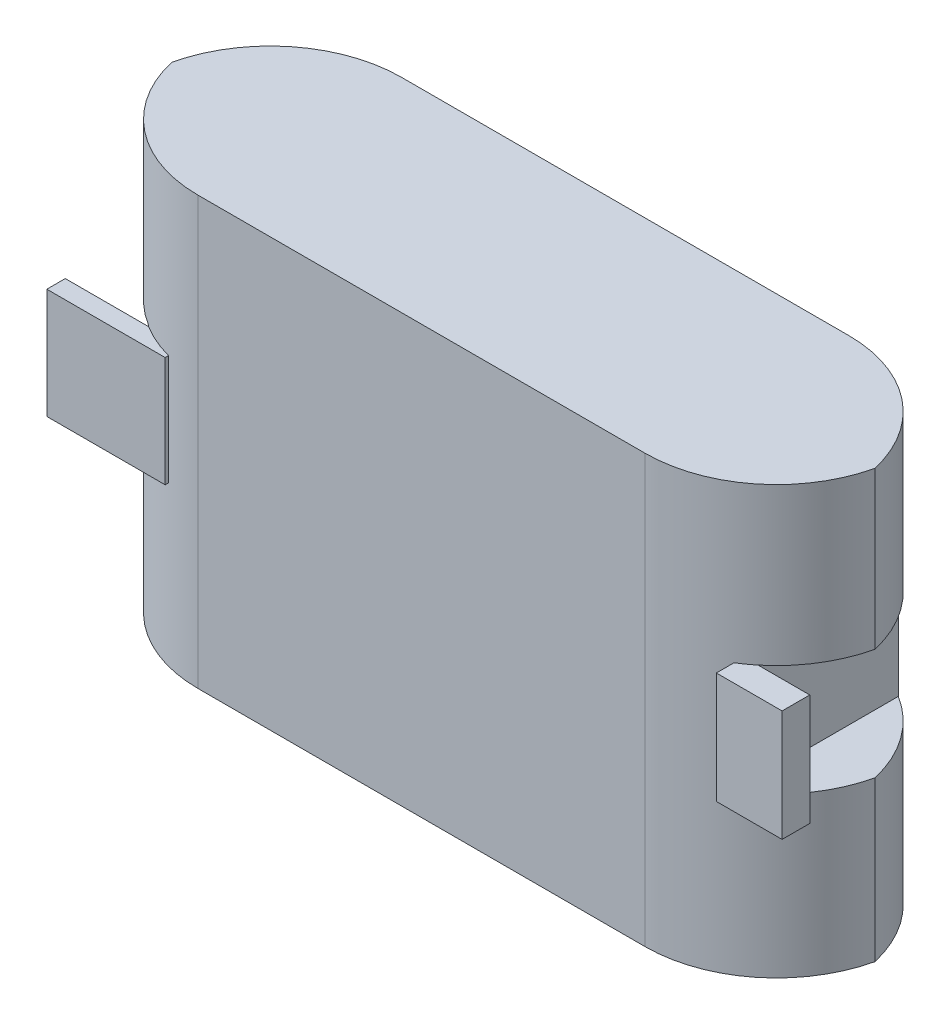
from build123d import *

# Parameters (mm, degrees)
SKETCH1_W           = 108
SKETCH1_H           = 65
BOSS_EXTRUDE1_DEPTH = 31
FILLET1_R           = 20
SKETCH2_W           = 11.536276889
SKETCH2_H           = 16.92742392
SKETCH2_W_2         = 26.268605015
CUT_EXTRUDE1_DEPTH  = 28
SKETCH3_W           = 2.805413746
SKETCH3_H           = 16.76973244
BOSS_EXTRUDE2_DEPTH = 18
SKETCH4_W           = 4.207099317
SKETCH4_H           = 16.92742392
BOSS_EXTRUDE3_DEPTH = 10


with BuildPart() as part:
    # Sketch1 → Boss-Extrude1 (new body)
    with BuildSketch(Plane.XY):
        with Locations((7.455924682, 4.284519209)):
            Rectangle(SKETCH1_W, SKETCH1_H)
    extrude(amount=BOSS_EXTRUDE1_DEPTH)

    # Fillet1
    # the kernel refuses this fillet: 20 mm, written as the material it takes off along each edge
    with BuildSketch(Plane(origin=(61.455924682, 86.784519209, 0), x_dir=(0, 0, 1), z_dir=(0, -1, 0)), Plane(origin=(-46.544075318, -78.215480791, 0), x_dir=(0, 0, 1), z_dir=(0, 1, 0))) as fillet1_piece_1:
        with BuildLine():
            CenterArc((FILLET1_R, FILLET1_R), FILLET1_R, 180, 90)
            Line((0, FILLET1_R), (0, 0))
            Line((0, 0), (FILLET1_R, 0))
        make_face()
    extrude(amount=165, mode=Mode.SUBTRACT)
    with BuildSketch(Plane(origin=(61.455924682, 86.784519209, 31), x_dir=(0, 0, -1), z_dir=(0, -1, 0)), Plane(origin=(-46.544075318, -78.215480791, 31), x_dir=(0, 0, -1), z_dir=(0, 1, 0))) as fillet1_piece_2:
        with BuildLine():
            CenterArc((FILLET1_R, -FILLET1_R), FILLET1_R, 90, 90)
            Line((0, -FILLET1_R), (0, 0))
            Line((0, 0), (FILLET1_R, 0))
        make_face()
    extrude(amount=165, mode=Mode.SUBTRACT)

    # Sketch2 → Cut-Extrude1 (cut)
    with BuildSketch(Plane(origin=(0, 0, 0), x_dir=(-1, 0, 0), z_dir=(0, 0, -1))):
        with Locations((-57.764364891, 4.474974683)):
            Rectangle(SKETCH2_W, SKETCH2_H)
        with Locations((44.830685277, 4.474974683)):
            Rectangle(SKETCH2_W_2, SKETCH2_H)
    extrude(amount=-CUT_EXTRUDE1_DEPTH, mode=Mode.SUBTRACT)

    # Sketch3 → Boss-Extrude2 (add)
    with BuildSketch(Plane.ZY.offset(31.696382769)):
        with Locations((29.429796439, 4.342088928)):
            Rectangle(SKETCH3_W, SKETCH3_H)
    extrude(amount=BOSS_EXTRUDE2_DEPTH)

    # Sketch4 → Boss-Extrude3 (add)
    with BuildSketch(Plane(origin=(51.996226446, 0, 0), x_dir=(0, 0, -1), z_dir=(1, 0, 0))):
        with Locations((-28.574605447, 4.474974683)):
            Rectangle(SKETCH4_W, SKETCH4_H)
    extrude(amount=BOSS_EXTRUDE3_DEPTH)


solid = part.part
